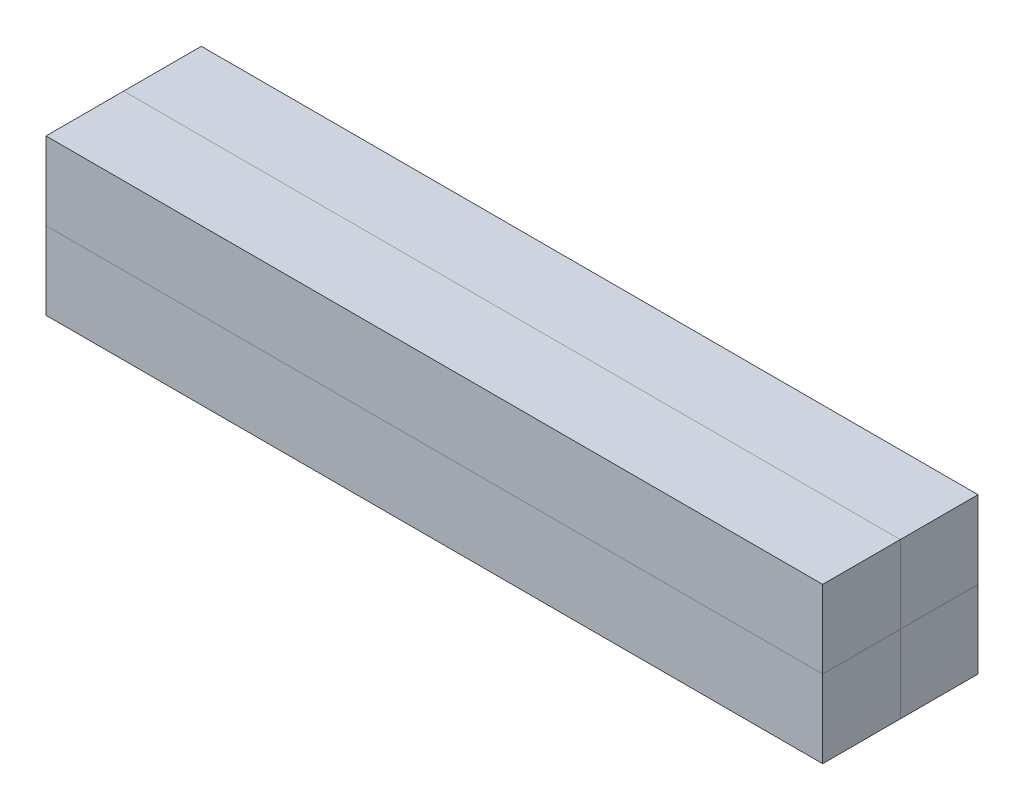
from build123d import *

# Parameters (mm, degrees)
SKETCH_1_W                 = 10
SKETCH_1_H                 = 10
EXTRUDE_1_DEPTH            = 50
SPLIT_START                = -5
SPLIT_BODIES_1_OUTLINE_W   = 50
SPLIT_BODIES_1_OUTLINE_H   = 5
SPLIT_BODIES_1_DEPTH       = 10
SPLIT_BODIES_1_2_OUTLINE_W = 50
SPLIT_BODIES_1_2_OUTLINE_H = 5
SPLIT_BODIES_1_2_DEPTH     = 5
SPLIT_BODIES_1_3_OUTLINE_W = 50
SPLIT_BODIES_1_3_OUTLINE_H = 5
SPLIT_BODIES_1_3_DEPTH     = 5
SPLIT_BODIES_1_4_OUTLINE_W = 50
SPLIT_BODIES_1_4_OUTLINE_H = 5
SPLIT_BODIES_1_4_DEPTH     = 5
SPLIT_BODIES_1_5_OUTLINE_W = 50
SPLIT_BODIES_1_5_OUTLINE_H = 5
SPLIT_BODIES_1_5_DEPTH     = 5


# Read off the part's stored shape, not the designer's step: Разделить1
with BuildPart() as part:
    # Эскиз1 → Бобышка-Вытянуть1 (new body)
    with BuildSketch(Plane(origin=(0, 0, 0), x_dir=(0, 0, -1), z_dir=(1, 0, 0))):
        Rectangle(SKETCH_1_W, SKETCH_1_H)
    extrude(amount=EXTRUDE_1_DEPTH)

    # Split Bodies 1 outline → Split Bodies 1 (cut)
    with BuildSketch(Plane.XY.offset(SPLIT_START)):
        with Locations((25, 2.5)):
            Rectangle(SPLIT_BODIES_1_OUTLINE_W, SPLIT_BODIES_1_OUTLINE_H)
    extrude(amount=SPLIT_BODIES_1_DEPTH, mode=Mode.SUBTRACT)

    # Split Bodies 1 2 outline → Split Bodies 1 2 (cut)
    with BuildSketch(Plane.XY):
        with Locations((25, -2.5)):
            Rectangle(SPLIT_BODIES_1_2_OUTLINE_W, SPLIT_BODIES_1_2_OUTLINE_H)
    extrude(amount=SPLIT_BODIES_1_2_DEPTH, mode=Mode.SUBTRACT)


with BuildPart() as body_2:
    # Split Bodies 1 3 outline → Split Bodies 1 3 (new body)
    with BuildSketch(Plane.XY):
        with Locations((25, 2.5)):
            Rectangle(SPLIT_BODIES_1_3_OUTLINE_W, SPLIT_BODIES_1_3_OUTLINE_H)
    extrude(amount=SPLIT_BODIES_1_3_DEPTH)


with BuildPart() as body_3:
    # Split Bodies 1 4 outline → Split Bodies 1 4 (new body)
    with BuildSketch(Plane.XY):
        with Locations((25, -2.5)):
            Rectangle(SPLIT_BODIES_1_4_OUTLINE_W, SPLIT_BODIES_1_4_OUTLINE_H)
    extrude(amount=SPLIT_BODIES_1_4_DEPTH)


with BuildPart() as body_4:
    # Split Bodies 1 5 outline → Split Bodies 1 5 (new body)
    with BuildSketch(Plane(origin=(0, 0, 0), x_dir=(1, 0, 0), z_dir=(0, 1, 0))):
        with Locations((25, 2.5)):
            Rectangle(SPLIT_BODIES_1_5_OUTLINE_W, SPLIT_BODIES_1_5_OUTLINE_H)
    extrude(amount=SPLIT_BODIES_1_5_DEPTH)


solid = Compound([part.part, body_2.part, body_3.part, body_4.part])
